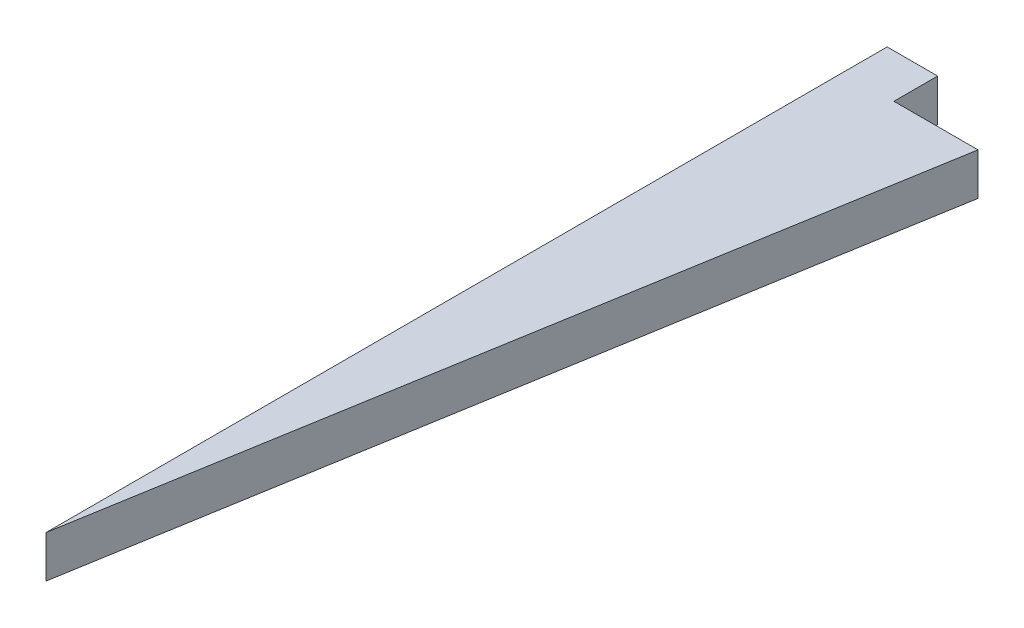
from build123d import *

# Parameters (mm, degrees)
SKETCH2_W                      = 304.8
SKETCH2_H                      = 304.8
BOSS_EXTRUDE1_DEPTH            = 3.175
CUT_EXTRUDE1_DEPTH             = 348.408852067
CUT_EXTRUDE1_DEPTH_BACK        = 348.408852067
SKETCH3_W                      = 304.8
SKETCH3_H                      = 304.8
SKETCH3_R                      = 12.7
SKETCH3_R_2                    = 8.89
BODY_DELETE_KEEP_1_OUTLINE_R   = 8.89
BODY_DELETE_KEEP_1_OUTLINE_R_2 = 12.7
BODY_DELETE_KEEP_1_DEPTH       = 3.175


# Read off the part's stored shape, not the designer's step: Body-Delete/Keep 1
with BuildPart() as part:
    # Sketch2 → Boss-Extrude1 (new body)
    with BuildSketch(Plane(origin=(0, 0, 0), x_dir=(1, 0, 0), z_dir=(0, 1, 0))):
        with Locations((-56.763509666, -124.968808797)):
            Rectangle(SKETCH2_W, SKETCH2_H)
    extrude(amount=BOSS_EXTRUDE1_DEPTH)

    # Sketch3 → Cut-Extrude1 (cut, two sides: drawn at the far end of the back side and taken through both)
    # profile 1 of 3: a face of its own
    with BuildSketch(Plane(origin=(0, 3.175, 0), x_dir=(1, 0, 0), z_dir=(0, 1, 0)).offset(-CUT_EXTRUDE1_DEPTH_BACK)):
        with Locations((-56.763509666, -124.968808797)):
            Rectangle(SKETCH3_W, SKETCH3_H)
        Polygon((-188.253637726, -268.695366412), (-192.063637726, -268.695366412), (-192.063637726, -265.393366412), (-198.413637726, -265.393366412), (-188.253637726, -205.195366412), align=None, mode=Mode.SUBTRACT)
        Polygon((-185.713637726, -265.393366412), (-175.553637726, -205.195366412), (-175.553637726, -268.695366412), (-179.363637726, -268.695366412), (-179.363637726, -265.393366412), align=None, mode=Mode.SUBTRACT)
        Polygon((-162.853637726, -268.695366412), (-166.663637726, -268.695366412), (-166.663637726, -265.393366412), (-173.013637726, -265.393366412), (-162.853637726, -205.195366412), align=None, mode=Mode.SUBTRACT)
        Polygon((-150.153637726, -268.695366412), (-153.963637726, -268.695366412), (-153.963637726, -265.393366412), (-160.313637726, -265.393366412), (-150.153637726, -205.195366412), align=None, mode=Mode.SUBTRACT)
        Polygon((-147.613637726, -265.393366412), (-137.453637726, -205.195366412), (-137.453637726, -268.695366412), (-141.263637726, -268.695366412), (-141.263637726, -265.393366412), align=None, mode=Mode.SUBTRACT)
        Polygon((-128.563637726, -265.393366412), (-134.913637726, -265.393366412), (-124.753637726, -205.195366412), (-124.753637726, -268.695366412), (-128.563637726, -268.695366412), align=None, mode=Mode.SUBTRACT)
        Polygon((-122.213637726, -265.393366412), (-112.053637726, -205.195366412), (-112.053637726, -268.695366412), (-115.863637726, -268.695366412), (-115.863637726, -265.393366412), align=None, mode=Mode.SUBTRACT)
        Polygon((-99.353637726, -268.695366412), (-103.163637726, -268.695366412), (-103.163637726, -265.393366412), (-109.513637726, -265.393366412), (-99.353637726, -205.195366412), align=None, mode=Mode.SUBTRACT)
        Polygon((-90.463637726, -268.695366412), (-90.463637726, -265.393366412), (-96.813637726, -265.393366412), (-86.653637726, -205.195366412), (-86.653637726, -268.695366412), align=None, mode=Mode.SUBTRACT)
        Polygon((-84.113637726, -265.393366412), (-73.953637726, -205.195366412), (-73.953637726, -268.695366412), (-77.763637726, -268.695366412), (-77.763637726, -265.393366412), align=None, mode=Mode.SUBTRACT)
        Polygon((-71.413637726, -265.393366412), (-61.253637726, -205.195366412), (-61.253637726, -268.695366412), (-65.063637726, -268.695366412), (-65.063637726, -265.393366412), align=None, mode=Mode.SUBTRACT)
        with BuildLine():
            ThreePointArc((-132.963509666, -135.600090559), (-133.446874634, -138.030130355), (-134.823381605, -140.09021862))
            Line((-134.823381605, -140.09021862), (-188.253637726, -193.520474741))
            ThreePointArc((-188.253637726, -193.520474741), (-190.313725991, -194.896981712), (-192.743765787, -195.38034668))
            Line((-192.743765787, -195.38034668), (-196.463509666, -195.38034668))
            Line((-196.463509666, -195.38034668), (-196.463509666, -131.88034668))
            Line((-196.463509666, -131.88034668), (-132.963509666, -131.88034668))
            Line((-132.963509666, -131.88034668), (-132.963509666, -135.600090559))
        make_face(mode=Mode.SUBTRACT)
        with BuildLine():
            Line((-126.613509666, -195.38034668), (-126.613509666, -131.88034668))
            Line((-126.613509666, -131.88034668), (-63.113509666, -131.88034668))
            Line((-63.113509666, -131.88034668), (-63.113509666, -135.600090559))
            ThreePointArc((-63.113509666, -135.600090559), (-63.596874634, -138.030130355), (-64.973381605, -140.09021862))
            Line((-64.973381605, -140.09021862), (-118.403637726, -193.520474741))
            ThreePointArc((-118.403637726, -193.520474741), (-120.463725991, -194.896981712), (-122.893765787, -195.38034668))
            Line((-122.893765787, -195.38034668), (-126.613509666, -195.38034668))
        make_face(mode=Mode.SUBTRACT)
        Polygon((-52.363637726, -268.695366412), (-52.363637726, -265.393366412), (-58.713637726, -265.393366412), (-48.553637726, -205.195366412), (-48.553637726, -268.695366412), align=None, mode=Mode.SUBTRACT)
        Polygon((-35.853637726, -205.195366412), (-35.853637726, -268.695366412), (-39.663637726, -268.695366412), (-39.663637726, -265.393366412), (-46.013637726, -265.393366412), align=None, mode=Mode.SUBTRACT)
        Polygon((-23.153637726, -205.195366412), (-23.153637726, -268.695366412), (-26.963637726, -268.695366412), (-26.963637726, -265.393366412), (-33.313637726, -265.393366412), align=None, mode=Mode.SUBTRACT)
        Polygon((-20.613637726, -265.393366412), (-10.453637726, -205.195366412), (-10.453637726, -268.695366412), (-14.263637726, -268.695366412), (-14.263637726, -265.393366412), align=None, mode=Mode.SUBTRACT)
        Polygon((-1.563637726, -268.695366412), (-1.563637726, -265.393366412), (-7.913637726, -265.393366412), (2.246362274, -205.195366412), (2.246362274, -268.695366412), align=None, mode=Mode.SUBTRACT)
        with BuildLine():
            Line((-53.043765787, -195.38034668), (-56.763509666, -195.38034668))
            Line((-56.763509666, -195.38034668), (-56.763509666, -131.88034668))
            Line((-56.763509666, -131.88034668), (6.736490334, -131.88034668))
            Line((6.736490334, -131.88034668), (6.736490334, -135.600090559))
            ThreePointArc((6.736490334, -135.600090559), (6.253125366, -138.030130355), (4.876618395, -140.09021862))
            Line((4.876618395, -140.09021862), (-48.553637726, -193.520474741))
            ThreePointArc((-48.553637726, -193.520474741), (-50.613725991, -194.896981712), (-53.043765787, -195.38034668))
        make_face(mode=Mode.SUBTRACT)
        with BuildLine():
            Line((13.086490334, -131.88034668), (76.586490334, -131.88034668))
            Line((76.586490334, -131.88034668), (76.586490334, -135.600090559))
            ThreePointArc((76.586490334, -135.600090559), (76.103125366, -138.030130355), (74.726618395, -140.09021862))
            Line((74.726618395, -140.09021862), (21.296362274, -193.520474741))
            ThreePointArc((21.296362274, -193.520474741), (19.236274009, -194.896981712), (16.806234213, -195.38034668))
            Line((16.806234213, -195.38034668), (13.086490334, -195.38034668))
            Line((13.086490334, -195.38034668), (13.086490334, -131.88034668))
        make_face(mode=Mode.SUBTRACT)
        with BuildLine():
            Line((-196.463509666, -125.53034668), (-196.463509666, -62.03034668))
            Line((-196.463509666, -62.03034668), (-132.963509666, -62.03034668))
            Line((-132.963509666, -62.03034668), (-132.963509666, -65.750090559))
            ThreePointArc((-132.963509666, -65.750090559), (-133.10773728, -67.095783354), (-133.533868437, -68.38034668))
            ThreePointArc((-133.533868437, -68.38034668), (-134.095097913, -69.368194866), (-134.823381605, -70.24021862))
            Line((-134.823381605, -70.24021862), (-188.253637726, -123.670474741))
            ThreePointArc((-188.253637726, -123.670474741), (-189.12566148, -124.398758433), (-190.113509666, -124.959987909))
            ThreePointArc((-190.113509666, -124.959987909), (-191.398072992, -125.386119066), (-192.743765787, -125.53034668))
            Line((-192.743765787, -125.53034668), (-196.463509666, -125.53034668))
        make_face(mode=Mode.SUBTRACT)
        with BuildLine():
            Line((-122.893765787, -125.53034668), (-126.613509666, -125.53034668))
            Line((-126.613509666, -125.53034668), (-126.613509666, -62.03034668))
            Line((-126.613509666, -62.03034668), (-63.113509666, -62.03034668))
            Line((-63.113509666, -62.03034668), (-63.113509666, -65.750090559))
            ThreePointArc((-63.113509666, -65.750090559), (-63.596874634, -68.180130355), (-64.973381605, -70.24021862))
            Line((-64.973381605, -70.24021862), (-118.403637726, -123.670474741))
            ThreePointArc((-118.403637726, -123.670474741), (-120.463725991, -125.046981712), (-122.893765787, -125.53034668))
        make_face(mode=Mode.SUBTRACT)
        Polygon((-196.463509666, -48.768808797), (-196.463509666, 14.731191203), (-192.653509666, 14.731191203), (-192.653509666, 11.429191203), (-186.303509666, 11.429191203), align=None, mode=Mode.SUBTRACT)
        Polygon((-183.763509666, 14.731191203), (-179.953509666, 14.731191203), (-179.953509666, 11.429191203), (-173.603509666, 11.429191203), (-183.763509666, -48.768808797), align=None, mode=Mode.SUBTRACT)
        Polygon((-171.063509666, 14.731191203), (-167.253509666, 14.731191203), (-167.253509666, 11.429191203), (-160.903509666, 11.429191203), (-171.063509666, -48.768808797), align=None, mode=Mode.SUBTRACT)
        Polygon((-158.363509666, 14.731191203), (-154.553509666, 14.731191203), (-154.553509666, 11.429191203), (-148.203509666, 11.429191203), (-158.363509666, -48.768808797), align=None, mode=Mode.SUBTRACT)
        Polygon((-145.663509666, 14.731191203), (-141.853509666, 14.731191203), (-141.853509666, 11.429191203), (-135.503509666, 11.429191203), (-145.663509666, -48.768808797), align=None, mode=Mode.SUBTRACT)
        Polygon((-132.963509666, 14.731191203), (-129.153509666, 14.731191203), (-129.153509666, 11.429191203), (-122.803509666, 11.429191203), (-132.963509666, -48.768808797), align=None, mode=Mode.SUBTRACT)
        Polygon((-120.263509666, 14.731191203), (-116.453509666, 14.731191203), (-116.453509666, 11.429191203), (-110.103509666, 11.429191203), (-120.263509666, -48.768808797), align=None, mode=Mode.SUBTRACT)
        Polygon((-107.563509666, 14.731191203), (-103.753509666, 14.731191203), (-103.753509666, 11.429191203), (-97.403509666, 11.429191203), (-107.563509666, -48.768808797), align=None, mode=Mode.SUBTRACT)
        Polygon((-94.863509666, 14.731191203), (-91.053509666, 14.731191203), (-91.053509666, 11.429191203), (-84.703509666, 11.429191203), (-94.863509666, -48.768808797), align=None, mode=Mode.SUBTRACT)
        Polygon((-82.163509666, 14.731191203), (-78.353509666, 14.731191203), (-78.353509666, 11.429191203), (-72.003509666, 11.429191203), (-82.163509666, -48.768808797), align=None, mode=Mode.SUBTRACT)
        Polygon((-69.463509666, 14.731191203), (-65.653509666, 14.731191203), (-65.653509666, 11.429191203), (-59.303509666, 11.429191203), (-69.463509666, -48.768808797), align=None, mode=Mode.SUBTRACT)
        with BuildLine():
            Line((-53.043765787, -125.53034668), (-56.763509666, -125.53034668))
            Line((-56.763509666, -125.53034668), (-56.763509666, -62.03034668))
            Line((-56.763509666, -62.03034668), (6.736490334, -62.03034668))
            Line((6.736490334, -62.03034668), (6.736490334, -65.750090559))
            ThreePointArc((6.736490334, -65.750090559), (6.253125366, -68.180130355), (4.876618395, -70.24021862))
            Line((4.876618395, -70.24021862), (-48.553637726, -123.670474741))
            ThreePointArc((-48.553637726, -123.670474741), (-50.613725991, -125.046981712), (-53.043765787, -125.53034668))
        make_face(mode=Mode.SUBTRACT)
        with BuildLine():
            Line((16.806234213, -125.53034668), (13.086490334, -125.53034668))
            Line((13.086490334, -125.53034668), (13.086490334, -62.03034668))
            Line((13.086490334, -62.03034668), (76.586490334, -62.03034668))
            Line((76.586490334, -62.03034668), (76.586490334, -65.750090559))
            ThreePointArc((76.586490334, -65.750090559), (76.103125366, -68.180130355), (74.726618395, -70.24021862))
            Line((74.726618395, -70.24021862), (21.296362274, -123.670474741))
            ThreePointArc((21.296362274, -123.670474741), (19.236274009, -125.046981712), (16.806234213, -125.53034668))
        make_face(mode=Mode.SUBTRACT)
        Polygon((-56.763509666, 14.731191203), (-52.953509666, 14.731191203), (-52.953509666, 11.429191203), (-46.603509666, 11.429191203), (-56.763509666, -48.768808797), align=None, mode=Mode.SUBTRACT)
        Polygon((-44.063509666, 14.731191203), (-40.253509666, 14.731191203), (-40.253509666, 11.429191203), (-33.903509666, 11.429191203), (-44.063509666, -48.768808797), align=None, mode=Mode.SUBTRACT)
        Polygon((-31.363509666, 14.731191203), (-27.553509666, 14.731191203), (-27.553509666, 11.429191203), (-21.203509666, 11.429191203), (-31.363509666, -48.768808797), align=None, mode=Mode.SUBTRACT)
        Polygon((-18.663509666, 14.731191203), (-14.853509666, 14.731191203), (-14.853509666, 11.429191203), (-8.503509666, 11.429191203), (-18.663509666, -48.768808797), align=None, mode=Mode.SUBTRACT)
        Polygon((-5.963509666, 14.731191203), (-2.153509666, 14.731191203), (-2.153509666, 11.429191203), (4.196490334, 11.429191203), (-5.963509666, -48.768808797), align=None, mode=Mode.SUBTRACT)
        Polygon((57.536490334, -48.768808797), (57.536490334, -52.070808797), (32.136490334, -52.070808797), (32.136490334, -48.768808797), (28.834490334, -48.768808797), (28.834490334, -23.368808797), (32.136490334, -23.368808797), (32.136490334, -20.066808797), (57.536490334, -20.066808797), (57.536490334, -23.368808797), (60.838490334, -23.368808797), (60.838490334, -48.768808797), align=None, mode=Mode.SUBTRACT)
        Polygon((28.834490334, 14.731191203), (32.136490334, 14.731191203), (32.136490334, 18.033191203), (57.536490334, 18.033191203), (57.536490334, 14.731191203), (60.838490334, 14.731191203), (60.838490334, -10.668808797), (57.536490334, -10.668808797), (57.536490334, -13.970808797), (32.136490334, -13.970808797), (32.136490334, -10.668808797), (28.834490334, -10.668808797), align=None, mode=Mode.SUBTRACT)
    # profile 2 of 3: a face of its own
    with BuildSketch(Plane(origin=(0, 3.175, 0), x_dir=(1, 0, 0), z_dir=(0, 1, 0)).offset(-CUT_EXTRUDE1_DEPTH_BACK)):
        with Locations(Location((44.836490334, -36.068808797, 0), (0, 0, 270))):
            Circle(SKETCH3_R)
    # profile 3 of 3: a face of its own
    with BuildSketch(Plane(origin=(0, 3.175, 0), x_dir=(1, 0, 0), z_dir=(0, 1, 0)).offset(-CUT_EXTRUDE1_DEPTH_BACK)):
        with Locations(Location((44.836490334, 2.031191203, 0), (0, 0, 270))):
            Circle(SKETCH3_R_2)
    extrude(amount=CUT_EXTRUDE1_DEPTH + CUT_EXTRUDE1_DEPTH_BACK, mode=Mode.SUBTRACT)

    # Body-Delete/Keep 1 outline → Body-Delete/Keep 1 (cut)
    # profile 1 of 41: a face of its own
    with BuildSketch(Plane(origin=(0, 0, 0), x_dir=(1, 0, 0), z_dir=(0, 1, 0))):
        Polygon((-5.963509666, -48.768808797), (4.196490334, 11.429191203), (-2.153509666, 11.429191203), (-2.153509666, 14.731191203), (-5.963509666, 14.731191203), align=None)
    # profile 2 of 41: a face of its own
    with BuildSketch(Plane(origin=(0, 0, 0), x_dir=(1, 0, 0), z_dir=(0, 1, 0))):
        Polygon((-31.363509666, -48.768808797), (-21.203509666, 11.429191203), (-27.553509666, 11.429191203), (-27.553509666, 14.731191203), (-31.363509666, 14.731191203), align=None)
    # profile 3 of 41: a face of its own
    with BuildSketch(Plane(origin=(0, 0, 0), x_dir=(1, 0, 0), z_dir=(0, 1, 0))):
        Polygon((-18.663509666, -48.768808797), (-8.503509666, 11.429191203), (-14.853509666, 11.429191203), (-14.853509666, 14.731191203), (-18.663509666, 14.731191203), align=None)
    # profile 4 of 41: a face of its own
    with BuildSketch(Plane(origin=(0, 0, 0), x_dir=(1, 0, 0), z_dir=(0, 1, 0))):
        Polygon((-69.463509666, -48.768808797), (-59.303509666, 11.429191203), (-65.653509666, 11.429191203), (-65.653509666, 14.731191203), (-69.463509666, 14.731191203), align=None)
    # profile 5 of 41: a face of its own
    with BuildSketch(Plane(origin=(0, 0, 0), x_dir=(1, 0, 0), z_dir=(0, 1, 0))):
        Polygon((-94.863509666, -48.768808797), (-84.703509666, 11.429191203), (-91.053509666, 11.429191203), (-91.053509666, 14.731191203), (-94.863509666, 14.731191203), align=None)
    # profile 6 of 41: a face of its own
    with BuildSketch(Plane(origin=(0, 0, 0), x_dir=(1, 0, 0), z_dir=(0, 1, 0))):
        Polygon((-44.063509666, -48.768808797), (-33.903509666, 11.429191203), (-40.253509666, 11.429191203), (-40.253509666, 14.731191203), (-44.063509666, 14.731191203), align=None)
    # profile 7 of 41: a face of its own
    with BuildSketch(Plane(origin=(0, 0, 0), x_dir=(1, 0, 0), z_dir=(0, 1, 0))):
        Polygon((-56.763509666, -48.768808797), (-46.603509666, 11.429191203), (-52.953509666, 11.429191203), (-52.953509666, 14.731191203), (-56.763509666, 14.731191203), align=None)
    # profile 8 of 41: a face of its own
    with BuildSketch(Plane(origin=(0, 0, 0), x_dir=(1, 0, 0), z_dir=(0, 1, 0))):
        Polygon((-145.663509666, -48.768808797), (-135.503509666, 11.429191203), (-141.853509666, 11.429191203), (-141.853509666, 14.731191203), (-145.663509666, 14.731191203), align=None)
    # profile 9 of 41: a face of its own
    with BuildSketch(Plane(origin=(0, 0, 0), x_dir=(1, 0, 0), z_dir=(0, 1, 0))):
        Polygon((-158.363509666, -48.768808797), (-148.203509666, 11.429191203), (-154.553509666, 11.429191203), (-154.553509666, 14.731191203), (-158.363509666, 14.731191203), align=None)
    # profile 10 of 41: a face of its own
    with BuildSketch(Plane(origin=(0, 0, 0), x_dir=(1, 0, 0), z_dir=(0, 1, 0))):
        Polygon((-171.063509666, -48.768808797), (-160.903509666, 11.429191203), (-167.253509666, 11.429191203), (-167.253509666, 14.731191203), (-171.063509666, 14.731191203), align=None)
    # profile 11 of 41: a face of its own
    with BuildSketch(Plane(origin=(0, 0, 0), x_dir=(1, 0, 0), z_dir=(0, 1, 0))):
        Polygon((-82.163509666, -48.768808797), (-72.003509666, 11.429191203), (-78.353509666, 11.429191203), (-78.353509666, 14.731191203), (-82.163509666, 14.731191203), align=None)
    # profile 12 of 41: a face of its own
    with BuildSketch(Plane(origin=(0, 0, 0), x_dir=(1, 0, 0), z_dir=(0, 1, 0))):
        Polygon((-183.763509666, -48.768808797), (-173.603509666, 11.429191203), (-179.953509666, 11.429191203), (-179.953509666, 14.731191203), (-183.763509666, 14.731191203), align=None)
    # profile 13 of 41: a face of its own
    with BuildSketch(Plane(origin=(0, 0, 0), x_dir=(1, 0, 0), z_dir=(0, 1, 0))):
        Polygon((-107.563509666, -48.768808797), (-97.403509666, 11.429191203), (-103.753509666, 11.429191203), (-103.753509666, 14.731191203), (-107.563509666, 14.731191203), align=None)
    # profile 14 of 41: a face of its own
    with BuildSketch(Plane(origin=(0, 0, 0), x_dir=(1, 0, 0), z_dir=(0, 1, 0))):
        Polygon((-120.263509666, -48.768808797), (-110.103509666, 11.429191203), (-116.453509666, 11.429191203), (-116.453509666, 14.731191203), (-120.263509666, 14.731191203), align=None)
    # profile 15 of 41: a face of its own
    with BuildSketch(Plane(origin=(0, 0, 0), x_dir=(1, 0, 0), z_dir=(0, 1, 0))):
        Polygon((-132.963509666, -48.768808797), (-122.803509666, 11.429191203), (-129.153509666, 11.429191203), (-129.153509666, 14.731191203), (-132.963509666, 14.731191203), align=None)
    # profile 16 of 41: a face of its own
    with BuildSketch(Plane(origin=(0, 0, 0), x_dir=(1, 0, 0), z_dir=(0, 1, 0))):
        with BuildLine():
            Line((-132.963509666, -62.03034668), (-196.463509666, -62.03034668))
            Line((-196.463509666, -62.03034668), (-196.463509666, -125.53034668))
            Line((-196.463509666, -125.53034668), (-192.743765787, -125.53034668))
            ThreePointArc((-192.743765787, -125.53034668), (-190.313725991, -125.046981712), (-188.253637726, -123.670474741))
            Line((-188.253637726, -123.670474741), (-134.823381605, -70.24021862))
            ThreePointArc((-134.823381605, -70.24021862), (-133.446874634, -68.180130355), (-132.963509666, -65.750090559))
            Line((-132.963509666, -65.750090559), (-132.963509666, -62.03034668))
        make_face()
    # profile 17 of 41: a face of its own
    with BuildSketch(Plane(origin=(0, 0, 0), x_dir=(1, 0, 0), z_dir=(0, 1, 0))):
        with BuildLine():
            Line((-132.963509666, -131.88034668), (-196.463509666, -131.88034668))
            Line((-196.463509666, -131.88034668), (-196.463509666, -195.38034668))
            Line((-196.463509666, -195.38034668), (-192.743765787, -195.38034668))
            ThreePointArc((-192.743765787, -195.38034668), (-190.313725991, -194.896981712), (-188.253637726, -193.520474741))
            Line((-188.253637726, -193.520474741), (-134.823381605, -140.09021862))
            ThreePointArc((-134.823381605, -140.09021862), (-133.446874634, -138.030130355), (-132.963509666, -135.600090559))
            Line((-132.963509666, -135.600090559), (-132.963509666, -131.88034668))
        make_face()
    # profile 18 of 41: a face of its own
    with BuildSketch(Plane(origin=(0, 0, 0), x_dir=(1, 0, 0), z_dir=(0, 1, 0))):
        Polygon((32.136490334, 18.033191203), (32.136490334, 14.731191203), (28.834490334, 14.731191203), (28.834490334, -10.668808797), (32.136490334, -10.668808797), (32.136490334, -13.970808797), (57.536490334, -13.970808797), (57.536490334, -10.668808797), (60.838490334, -10.668808797), (60.838490334, 14.731191203), (57.536490334, 14.731191203), (57.536490334, 18.033191203), align=None)
        with Locations((44.836490334, 2.031191203)):
            Circle(BODY_DELETE_KEEP_1_OUTLINE_R, mode=Mode.SUBTRACT)
    # profile 19 of 41: a face of its own
    with BuildSketch(Plane(origin=(0, 0, 0), x_dir=(1, 0, 0), z_dir=(0, 1, 0))):
        Polygon((32.136490334, -20.066808797), (32.136490334, -23.368808797), (28.834490334, -23.368808797), (28.834490334, -48.768808797), (32.136490334, -48.768808797), (32.136490334, -52.070808797), (57.536490334, -52.070808797), (57.536490334, -48.768808797), (60.838490334, -48.768808797), (60.838490334, -23.368808797), (57.536490334, -23.368808797), (57.536490334, -20.066808797), align=None)
        with Locations((44.836490334, -36.068808797)):
            Circle(BODY_DELETE_KEEP_1_OUTLINE_R_2, mode=Mode.SUBTRACT)
    # profile 20 of 41: a face of its own
    with BuildSketch(Plane(origin=(0, 0, 0), x_dir=(1, 0, 0), z_dir=(0, 1, 0))):
        Polygon((-71.413637726, -265.393366412), (-65.063637726, -265.393366412), (-65.063637726, -268.695366412), (-61.253637726, -268.695366412), (-61.253637726, -205.195366412), align=None)
    # profile 21 of 41: a face of its own
    with BuildSketch(Plane(origin=(0, 0, 0), x_dir=(1, 0, 0), z_dir=(0, 1, 0))):
        Polygon((-124.753637726, -205.195366412), (-134.913637726, -265.393366412), (-128.563637726, -265.393366412), (-128.563637726, -268.695366412), (-124.753637726, -268.695366412), align=None)
    # profile 22 of 41: a face of its own
    with BuildSketch(Plane(origin=(0, 0, 0), x_dir=(1, 0, 0), z_dir=(0, 1, 0))):
        Polygon((-23.153637726, -205.195366412), (-33.313637726, -265.393366412), (-26.963637726, -265.393366412), (-26.963637726, -268.695366412), (-23.153637726, -268.695366412), align=None)
    # profile 23 of 41: a face of its own
    with BuildSketch(Plane(origin=(0, 0, 0), x_dir=(1, 0, 0), z_dir=(0, 1, 0))):
        Polygon((-35.853637726, -205.195366412), (-46.013637726, -265.393366412), (-39.663637726, -265.393366412), (-39.663637726, -268.695366412), (-35.853637726, -268.695366412), align=None)
    # profile 24 of 41: a face of its own
    with BuildSketch(Plane(origin=(0, 0, 0), x_dir=(1, 0, 0), z_dir=(0, 1, 0))):
        Polygon((-73.953637726, -205.195366412), (-84.113637726, -265.393366412), (-77.763637726, -265.393366412), (-77.763637726, -268.695366412), (-73.953637726, -268.695366412), align=None)
    # profile 25 of 41: a face of its own
    with BuildSketch(Plane(origin=(0, 0, 0), x_dir=(1, 0, 0), z_dir=(0, 1, 0))):
        Polygon((-162.853637726, -205.195366412), (-173.013637726, -265.393366412), (-166.663637726, -265.393366412), (-166.663637726, -268.695366412), (-162.853637726, -268.695366412), align=None)
    # profile 26 of 41: a face of its own
    with BuildSketch(Plane(origin=(0, 0, 0), x_dir=(1, 0, 0), z_dir=(0, 1, 0))):
        Polygon((-188.253637726, -205.195366412), (-198.413637726, -265.393366412), (-192.063637726, -265.393366412), (-192.063637726, -268.695366412), (-188.253637726, -268.695366412), align=None)
    # profile 27 of 41: a face of its own
    with BuildSketch(Plane(origin=(0, 0, 0), x_dir=(1, 0, 0), z_dir=(0, 1, 0))):
        Polygon((-175.553637726, -205.195366412), (-185.713637726, -265.393366412), (-179.363637726, -265.393366412), (-179.363637726, -268.695366412), (-175.553637726, -268.695366412), align=None)
    # profile 28 of 41: a face of its own
    with BuildSketch(Plane(origin=(0, 0, 0), x_dir=(1, 0, 0), z_dir=(0, 1, 0))):
        Polygon((-150.153637726, -205.195366412), (-160.313637726, -265.393366412), (-153.963637726, -265.393366412), (-153.963637726, -268.695366412), (-150.153637726, -268.695366412), align=None)
    # profile 29 of 41: a face of its own
    with BuildSketch(Plane(origin=(0, 0, 0), x_dir=(1, 0, 0), z_dir=(0, 1, 0))):
        Polygon((-86.653637726, -205.195366412), (-96.813637726, -265.393366412), (-90.463637726, -265.393366412), (-90.463637726, -268.695366412), (-86.653637726, -268.695366412), align=None)
    # profile 30 of 41: a face of its own
    with BuildSketch(Plane(origin=(0, 0, 0), x_dir=(1, 0, 0), z_dir=(0, 1, 0))):
        Polygon((2.246362274, -205.195366412), (-7.913637726, -265.393366412), (-1.563637726, -265.393366412), (-1.563637726, -268.695366412), (2.246362274, -268.695366412), align=None)
    # profile 31 of 41: a face of its own
    with BuildSketch(Plane(origin=(0, 0, 0), x_dir=(1, 0, 0), z_dir=(0, 1, 0))):
        Polygon((-137.453637726, -205.195366412), (-147.613637726, -265.393366412), (-141.263637726, -265.393366412), (-141.263637726, -268.695366412), (-137.453637726, -268.695366412), align=None)
    # profile 32 of 41: a face of its own
    with BuildSketch(Plane(origin=(0, 0, 0), x_dir=(1, 0, 0), z_dir=(0, 1, 0))):
        Polygon((-48.553637726, -205.195366412), (-58.713637726, -265.393366412), (-52.363637726, -265.393366412), (-52.363637726, -268.695366412), (-48.553637726, -268.695366412), align=None)
    # profile 33 of 41: a face of its own
    with BuildSketch(Plane(origin=(0, 0, 0), x_dir=(1, 0, 0), z_dir=(0, 1, 0))):
        Polygon((-10.453637726, -205.195366412), (-20.613637726, -265.393366412), (-14.263637726, -265.393366412), (-14.263637726, -268.695366412), (-10.453637726, -268.695366412), align=None)
    # profile 34 of 41: a face of its own
    with BuildSketch(Plane(origin=(0, 0, 0), x_dir=(1, 0, 0), z_dir=(0, 1, 0))):
        Polygon((-99.353637726, -205.195366412), (-109.513637726, -265.393366412), (-103.163637726, -265.393366412), (-103.163637726, -268.695366412), (-99.353637726, -268.695366412), align=None)
    # profile 35 of 41: a face of its own
    with BuildSketch(Plane(origin=(0, 0, 0), x_dir=(1, 0, 0), z_dir=(0, 1, 0))):
        Polygon((-112.053637726, -205.195366412), (-122.213637726, -265.393366412), (-115.863637726, -265.393366412), (-115.863637726, -268.695366412), (-112.053637726, -268.695366412), align=None)
    # profile 36 of 41: a face of its own
    with BuildSketch(Plane(origin=(0, 0, 0), x_dir=(1, 0, 0), z_dir=(0, 1, 0))):
        with BuildLine():
            Line((6.736490334, -131.88034668), (-56.763509666, -131.88034668))
            Line((-56.763509666, -131.88034668), (-56.763509666, -195.38034668))
            Line((-56.763509666, -195.38034668), (-53.043765787, -195.38034668))
            ThreePointArc((-53.043765787, -195.38034668), (-50.613725991, -194.896981712), (-48.553637726, -193.520474741))
            Line((-48.553637726, -193.520474741), (4.876618395, -140.09021862))
            ThreePointArc((4.876618395, -140.09021862), (6.253125366, -138.030130355), (6.736490334, -135.600090559))
            Line((6.736490334, -135.600090559), (6.736490334, -131.88034668))
        make_face()
    # profile 37 of 41: a face of its own
    with BuildSketch(Plane(origin=(0, 0, 0), x_dir=(1, 0, 0), z_dir=(0, 1, 0))):
        with BuildLine():
            Line((6.736490334, -62.03034668), (-56.763509666, -62.03034668))
            Line((-56.763509666, -62.03034668), (-56.763509666, -125.53034668))
            Line((-56.763509666, -125.53034668), (-53.043765787, -125.53034668))
            ThreePointArc((-53.043765787, -125.53034668), (-50.613725991, -125.046981712), (-48.553637726, -123.670474741))
            Line((-48.553637726, -123.670474741), (4.876618395, -70.24021862))
            ThreePointArc((4.876618395, -70.24021862), (6.253125366, -68.180130355), (6.736490334, -65.750090559))
            Line((6.736490334, -65.750090559), (6.736490334, -62.03034668))
        make_face()
    # profile 38 of 41: a face of its own
    with BuildSketch(Plane(origin=(0, 0, 0), x_dir=(1, 0, 0), z_dir=(0, 1, 0))):
        with BuildLine():
            Line((21.296362274, -193.520474741), (74.726618395, -140.09021862))
            ThreePointArc((74.726618395, -140.09021862), (76.103125366, -138.030130355), (76.586490334, -135.600090559))
            Line((76.586490334, -135.600090559), (76.586490334, -131.88034668))
            Line((76.586490334, -131.88034668), (13.086490334, -131.88034668))
            Line((13.086490334, -131.88034668), (13.086490334, -195.38034668))
            Line((13.086490334, -195.38034668), (16.806234213, -195.38034668))
            ThreePointArc((16.806234213, -195.38034668), (19.236274009, -194.896981712), (21.296362274, -193.520474741))
        make_face()
    # profile 39 of 41: a face of its own
    with BuildSketch(Plane(origin=(0, 0, 0), x_dir=(1, 0, 0), z_dir=(0, 1, 0))):
        with BuildLine():
            Line((-126.613509666, -131.88034668), (-126.613509666, -195.38034668))
            Line((-126.613509666, -195.38034668), (-122.893765787, -195.38034668))
            ThreePointArc((-122.893765787, -195.38034668), (-120.463725991, -194.896981712), (-118.403637726, -193.520474741))
            Line((-118.403637726, -193.520474741), (-64.973381605, -140.09021862))
            ThreePointArc((-64.973381605, -140.09021862), (-63.596874634, -138.030130355), (-63.113509666, -135.600090559))
            Line((-63.113509666, -135.600090559), (-63.113509666, -131.88034668))
            Line((-63.113509666, -131.88034668), (-126.613509666, -131.88034668))
        make_face()
    # profile 40 of 41: a face of its own
    with BuildSketch(Plane(origin=(0, 0, 0), x_dir=(1, 0, 0), z_dir=(0, 1, 0))):
        with BuildLine():
            Line((76.586490334, -62.03034668), (13.086490334, -62.03034668))
            Line((13.086490334, -62.03034668), (13.086490334, -125.53034668))
            Line((13.086490334, -125.53034668), (16.806234213, -125.53034668))
            ThreePointArc((16.806234213, -125.53034668), (19.236274009, -125.046981712), (21.296362274, -123.670474741))
            Line((21.296362274, -123.670474741), (74.726618395, -70.24021862))
            ThreePointArc((74.726618395, -70.24021862), (76.103125366, -68.180130355), (76.586490334, -65.750090559))
            Line((76.586490334, -65.750090559), (76.586490334, -62.03034668))
        make_face()
    # profile 41 of 41: a face of its own
    with BuildSketch(Plane(origin=(0, 0, 0), x_dir=(1, 0, 0), z_dir=(0, 1, 0))):
        with BuildLine():
            Line((-126.613509666, -62.03034668), (-126.613509666, -125.53034668))
            Line((-126.613509666, -125.53034668), (-122.893765787, -125.53034668))
            ThreePointArc((-122.893765787, -125.53034668), (-120.463725991, -125.046981712), (-118.403637726, -123.670474741))
            Line((-118.403637726, -123.670474741), (-64.973381605, -70.24021862))
            ThreePointArc((-64.973381605, -70.24021862), (-63.596874634, -68.180130355), (-63.113509666, -65.750090559))
            Line((-63.113509666, -65.750090559), (-63.113509666, -62.03034668))
            Line((-63.113509666, -62.03034668), (-126.613509666, -62.03034668))
        make_face()
    extrude(amount=BODY_DELETE_KEEP_1_DEPTH, mode=Mode.SUBTRACT)


solid = part.part
